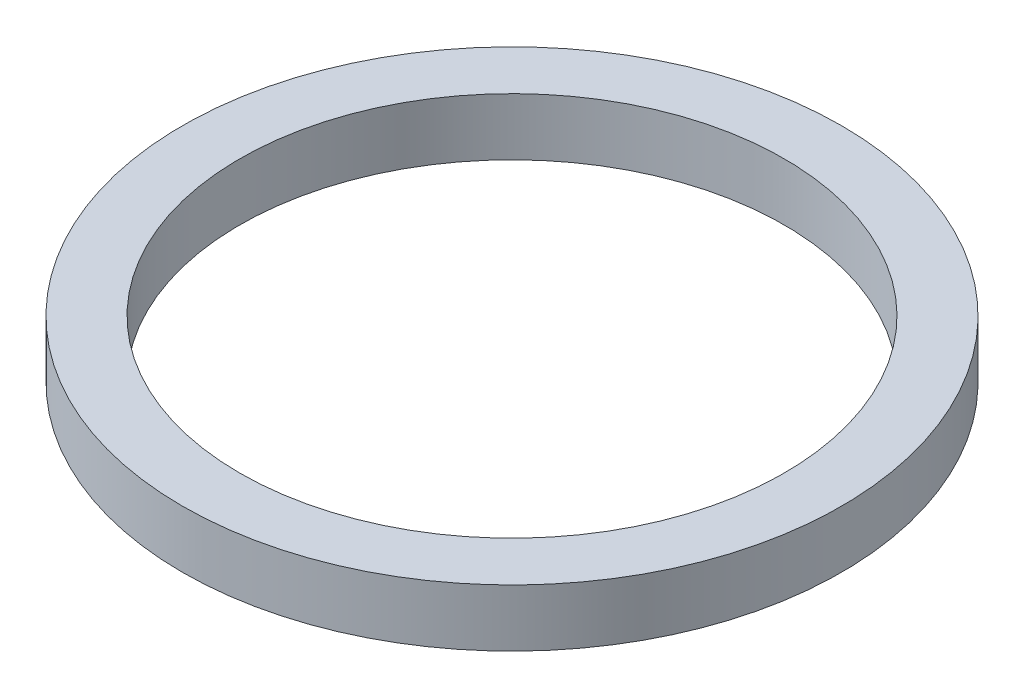
from build123d import *

# Parameters (mm, degrees)
SKETCH1_R           = 57.5
BOSS_EXTRUDE1_DEPTH = 10
SKETCH2_R           = 47.5
CUT_EXTRUDE1_DEPTH  = 82.929848041


with BuildPart() as part:
    # Sketch1 → Boss-Extrude1 (new body)
    with BuildSketch(Plane(origin=(0, 0, 0), x_dir=(1, 0, 0), z_dir=(0, 1, 0))):
        Circle(SKETCH1_R)
    extrude(amount=BOSS_EXTRUDE1_DEPTH)

    # Sketch2 → Cut-Extrude1 (cut, through all)
    with BuildSketch(Plane(origin=(0, 0, 0), x_dir=(1, 0, 0), z_dir=(0, 1, 0))):
        Circle(SKETCH2_R)
    extrude(amount=CUT_EXTRUDE1_DEPTH, mode=Mode.SUBTRACT)


solid = part.part
